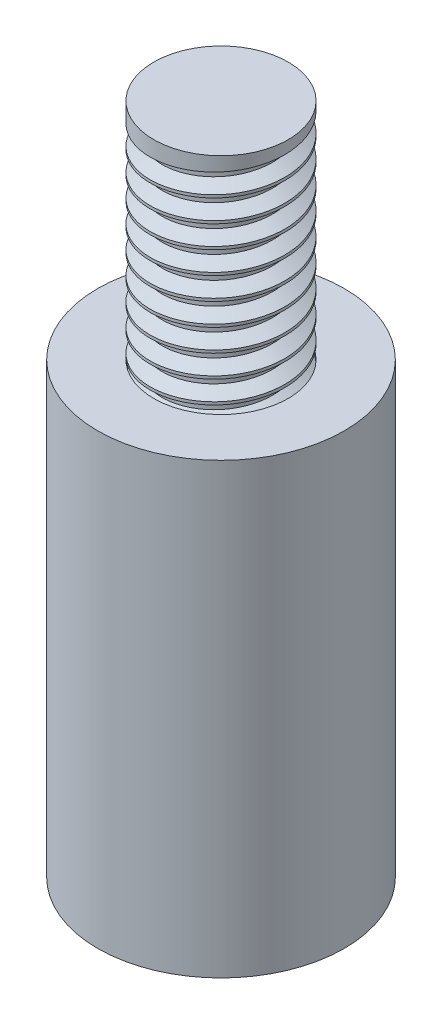
from build123d import *

# Parameters (mm, degrees)
ROSCA2_PITCH = 0.5
ROSCA3_PITCH = 0.5


with BuildPart() as part:
    # Croquis2 → Revolución1 (revolve)
    with BuildSketch(Plane.XY, mode=Mode.PRIVATE) as revoluci_n1_sk:
        Polygon((-65.956148613, 0), (-65.956148613, 10), (-64.706148613, 10), (-64.706148613, 15), (-63.206148613, 15), (-63.206148613, 10), (-63.206148613, 3), (-64.706148613, 3), (-64.706148613, 0), align=None)
    revolve(revoluci_n1_sk.sketch.rotate(Axis((-63.206148613, 10, 0), (0, 1, 0)), 270), axis=Axis((-63.206148613, 10, 0), (0, 1, 0)))

    # Rosca2: the profile of Perfil de rosca3 profile screwed along a right-hand helix of 10 turns, 6 arcs to a turn; built about Z, then put on its axis
    rosca2_z = Axis((0, 0, 0), (0, 0, 1))
    rosca2_corners = [(1.5003, 0, -0.000173205), (1.5003, 0, 0.437673204), (1.229367063, 0, 0.281249999), (1.229367063, 0, 0.156249999)]
    with BuildLine(mode=Mode.PRIVATE) as rosca2_profile:
        Line(rosca2_corners[0], rosca2_corners[1])
        Line(rosca2_corners[1], rosca2_corners[2])
        Line(rosca2_corners[2], rosca2_corners[3])
        Line(rosca2_corners[3], rosca2_corners[0])
    rosca2_cap = Face(rosca2_profile.wire())
    rosca2_turn_angles = [0, 30, 60, 90, 120, 150, 180, 210, 240, 270, 300, 330, 360]
    rosca2_turn_weights = [1, 0.8660254037844387, 1, 0.8660254037844387, 1, 0.8660254037844387, 1, 0.8660254037844387, 1, 0.8660254037844387, 1, 0.8660254037844387, 1]
    rosca2_turn_rails = [Edge.make_bspline([Vector(p[0], p[1], 0).rotate(rosca2_z, rosca2_turn_angles[k]) / rosca2_turn_weights[k] + Vector(0, 0, p[2] + ROSCA2_PITCH * rosca2_turn_angles[k] / 360) for k in range(13)], [0, 0, 0, 1, 1, 2, 2, 3, 3, 4, 4, 5, 5, 6, 6, 6], 2, rosca2_turn_weights) for p in rosca2_corners]
    rosca2_turn_sides = [Face.make_surface_from_curves(rosca2_turn_rails[p[0]], rosca2_turn_rails[p[1]]) for p in [(0, 1), (1, 2), (2, 3), (3, 0)]]
    rosca2 = Plane(origin=(-63.206148613, 15, 0), x_dir=(-1, 0, 0), z_dir=(0, -1, 0)) * Solid(Shell([*[p.moved(Location((0, 0, ROSCA2_PITCH * i))) for i in range(10) for p in rosca2_turn_sides], rosca2_cap, rosca2_cap.rotate(rosca2_z, 3600).moved(Location((0, 0, ROSCA2_PITCH * 3600 / 360)))]))
    add(rosca2, mode=Mode.SUBTRACT)

    # Rosca3: the profile of Perfil de rosca4 profile screwed along a right-hand helix of 6 turns, 6 arcs to a turn; built about Z, then put on its axis
    rosca3_z = Axis((0, 0, 0), (0, 0, 1))
    rosca3_corners = [(1.5003, 0, -0.000173205), (1.5003, 0, 0.437673204), (1.229367062, 0, 0.281249999), (1.229367062, 0, 0.156249999)]
    with BuildLine(mode=Mode.PRIVATE) as rosca3_profile:
        Line(rosca3_corners[0], rosca3_corners[1])
        Line(rosca3_corners[1], rosca3_corners[2])
        Line(rosca3_corners[2], rosca3_corners[3])
        Line(rosca3_corners[3], rosca3_corners[0])
    rosca3_cap = Face(rosca3_profile.wire())
    rosca3_turn_angles = [0, 30, 60, 90, 120, 150, 180, 210, 240, 270, 300, 330, 360]
    rosca3_turn_weights = [1, 0.8660254037844387, 1, 0.8660254037844387, 1, 0.8660254037844387, 1, 0.8660254037844387, 1, 0.8660254037844387, 1, 0.8660254037844387, 1]
    rosca3_turn_rails = [Edge.make_bspline([Vector(p[0], p[1], 0).rotate(rosca3_z, rosca3_turn_angles[k]) / rosca3_turn_weights[k] + Vector(0, 0, p[2] + ROSCA3_PITCH * rosca3_turn_angles[k] / 360) for k in range(13)], [0, 0, 0, 1, 1, 2, 2, 3, 3, 4, 4, 5, 5, 6, 6, 6], 2, rosca3_turn_weights) for p in rosca3_corners]
    rosca3_turn_sides = [Face.make_surface_from_curves(rosca3_turn_rails[p[0]], rosca3_turn_rails[p[1]]) for p in [(0, 1), (1, 2), (2, 3), (3, 0)]]
    rosca3 = Plane(origin=(-63.206148613, 0, 0), x_dir=(1, 0, 0), z_dir=(0, 1, 0)) * Solid(Shell([*[p.moved(Location((0, 0, ROSCA3_PITCH * i))) for i in range(6) for p in rosca3_turn_sides], rosca3_cap, rosca3_cap.rotate(rosca3_z, 2160).moved(Location((0, 0, ROSCA3_PITCH * 2160 / 360)))]))
    add(rosca3)


solid = part.part
